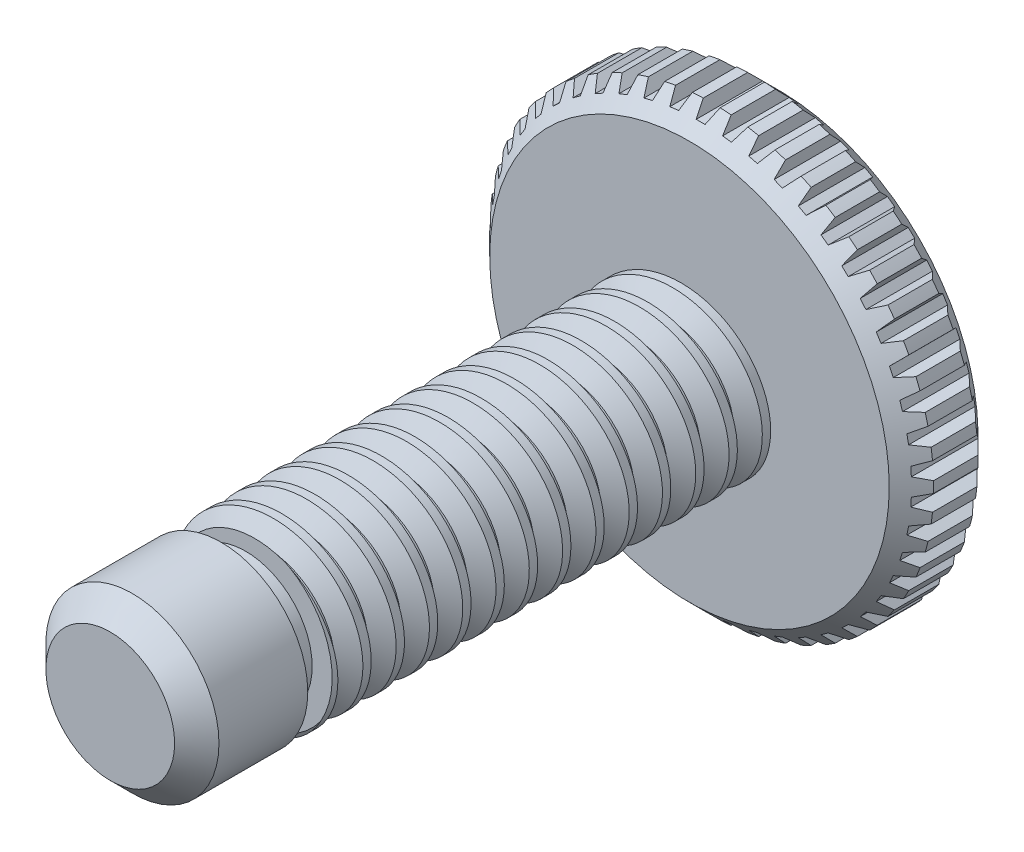
from build123d import *

# Parameters (mm, degrees)
SKETCH1_R           = 3.9
BOSS_EXTRUDE1_DEPTH = 20
THREAD1_PITCH       = 1.5
SKETCH2_R           = 10
BOSS_EXTRUDE2_DEPTH = 4
SKETCH3_R           = 3
BOSS_EXTRUDE3_DEPTH = 1.1
SKETCH4_R           = 3.9
BOSS_EXTRUDE4_DEPTH = 5
CHAMFER1_SIZE       = 1
CUT_EXTRUDE1_DEPTH  = 5
CHAMFER2_SIZE       = 1


with BuildPart() as part:
    # Sketch1 → Boss-Extrude1 (new body)
    with BuildSketch(Plane.XY):
        Circle(SKETCH1_R)
    extrude(amount=BOSS_EXTRUDE1_DEPTH)

    # Thread1: the profile of Thread Profile1 profile screwed along a right-hand helix of 16.666667 turns, 8 arcs to a turn; built about Z, then put on its axis
    thread1_z = Axis((0, 0, 0), (0, 0, 1))
    thread1_corners = [(3.9003, 0, -0.000173205), (3.088101187, 0, 0.468749998), (3.088101187, 0, 0.656249998), (3.9003, 0, 1.125173201)]
    with BuildLine(mode=Mode.PRIVATE) as thread1_profile:
        Line(thread1_corners[0], thread1_corners[1])
        Line(thread1_corners[1], thread1_corners[2])
        Line(thread1_corners[2], thread1_corners[3])
        Line(thread1_corners[3], thread1_corners[0])
    thread1_cap = Face(thread1_profile.wire())
    thread1_turn_angles = [0, 22.5, 45, 67.5, 90, 112.5, 135, 157.5, 180, 202.5, 225, 247.5, 270, 292.5, 315, 337.5, 360]
    thread1_turn_weights = [1, 0.9238795325112867, 1, 0.9238795325112867, 1, 0.9238795325112867, 1, 0.9238795325112867, 1, 0.9238795325112867, 1, 0.9238795325112867, 1, 0.9238795325112867, 1, 0.9238795325112867, 1]
    thread1_turn_rails = [Edge.make_bspline([Vector(p[0], p[1], 0).rotate(thread1_z, thread1_turn_angles[k]) / thread1_turn_weights[k] + Vector(0, 0, p[2] + THREAD1_PITCH * thread1_turn_angles[k] / 360) for k in range(17)], [0, 0, 0, 1, 1, 2, 2, 3, 3, 4, 4, 5, 5, 6, 6, 7, 7, 8, 8, 8], 2, thread1_turn_weights) for p in thread1_corners]
    thread1_turn_sides = [Face.make_surface_from_curves(thread1_turn_rails[p[0]], thread1_turn_rails[p[1]]) for p in [(0, 1), (1, 2), (2, 3), (3, 0)]]
    thread1_last_angles = [5760, 5782.5, 5805, 5827.5, 5850, 5872.5, 5895, 5917.5, 5940, 5962.5, 5985, 5992.5, 6000]
    thread1_last_weights = [1, 0.9238795325112867, 1, 0.9238795325112867, 1, 0.9238795325112867, 1, 0.9238795325112867, 1, 0.9238795325112867, 1, 0.9914448613738115, 1]
    thread1_last_rails = [Edge.make_bspline([Vector(p[0], p[1], 0).rotate(thread1_z, thread1_last_angles[k]) / thread1_last_weights[k] + Vector(0, 0, p[2] + THREAD1_PITCH * thread1_last_angles[k] / 360) for k in range(13)], [0, 0, 0, 1, 1, 2, 2, 3, 3, 4, 4, 5, 5, 6, 6, 6], 2, thread1_last_weights) for p in thread1_corners]
    thread1_last_sides = [Face.make_surface_from_curves(thread1_last_rails[p[0]], thread1_last_rails[p[1]]) for p in [(0, 1), (1, 2), (2, 3), (3, 0)]]
    thread1 = Plane(origin=(0, 0, 22), x_dir=(-1, 0, 0), z_dir=(0, 0, -1)) * Solid(Shell([*[p.moved(Location((0, 0, THREAD1_PITCH * i))) for i in range(16) for p in thread1_turn_sides], *thread1_last_sides, thread1_cap, thread1_cap.rotate(thread1_z, 6000).moved(Location((0, 0, THREAD1_PITCH * 6000 / 360)))]))
    add(thread1, mode=Mode.SUBTRACT)

    # Sketch2 → Boss-Extrude2 (add)
    with BuildSketch(Plane(origin=(0, 0, 0), x_dir=(-1, 0, 0), z_dir=(0, 0, -1))):
        Circle(SKETCH2_R)
    extrude(amount=BOSS_EXTRUDE2_DEPTH)

    # Sketch3 → Boss-Extrude3 (add)
    with BuildSketch(Plane.XY.offset(20)):
        Circle(SKETCH3_R)
    extrude(amount=BOSS_EXTRUDE3_DEPTH)

    # Sketch4 → Boss-Extrude4 (add)
    with BuildSketch(Plane.XY.offset(21.1)):
        Circle(SKETCH4_R)
    extrude(amount=BOSS_EXTRUDE4_DEPTH)

    # Chamfer1
    chamfer1_edges = [part.edges().sort_by_distance(p)[0] for p in [
        (10, 0, 0),
        (10, 0, -4),
    ]]
    chamfer(chamfer1_edges, length=CHAMFER1_SIZE)

    # Sketch5 → Cut-Extrude1 (cut)
    with BuildSketch(Plane(origin=(0, 0, -4), x_dir=(-1, 0, 0), z_dir=(0, 0, -1))):
        with BuildLine():
            Line((-0.2, 9.5), (0.2, 9.5))
            Line((0.2, 9.5), (0.379365083, 9.992801516))
            ThreePointArc((0.379365083, 9.992801516), (0, 10.02266576), (-0.379365083, 9.992801516))
            Line((-0.379365083, 9.992801516), (-0.2, 9.5))
        make_face()
        with BuildLine():
            Line((1.389088659, 9.400023016), (1.628803802, 9.866458239))
            ThreePointArc((1.628803802, 9.866458239), (1.256173109, 9.943634046), (0.87605645, 9.961552344))
            Line((0.87605645, 9.961552344), (0.992242779, 9.450156309))
            Line((0.992242779, 9.450156309), (1.389088659, 9.400023016))
        make_face()
        with BuildLine():
            Line((2.55627056, 9.151802053), (2.852555313, 9.584515021))
            ThreePointArc((2.852555313, 9.584515021), (2.492535617, 9.707785284), (2.11766205, 9.77320354))
            Line((2.11766205, 9.77320354), (2.168837296, 9.251278008))
            Line((2.168837296, 9.251278008), (2.55627056, 9.151802053))
        make_face()
        with BuildLine():
            Line((3.683138548, 8.759251705), (4.031320322, 9.151418276))
            ThreePointArc((4.031320322, 9.151418276), (3.689589349, 9.318838949), (3.325870854, 9.430725479))
            Line((3.325870854, 9.430725479), (3.311227953, 8.906501526))
            Line((3.311227953, 8.906501526), (3.683138548, 8.759251705))
        make_face()
        with BuildLine():
            Line((4.75192124, 8.228562726), (5.146509001, 8.573998198))
            ThreePointArc((5.146509001, 8.573998198), (4.828456054, 8.782928957), (4.481628688, 8.939519243))
            Line((4.481628688, 8.939519243), (4.401398568, 8.421264195))
            Line((4.401398568, 8.421264195), (4.75192124, 8.228562726))
        make_face()
        with BuildLine():
            Line((5.745763296, 7.568104396), (6.180534159, 7.861361047))
            ThreePointArc((6.180534159, 7.861361047), (5.891175122, 8.108506928), (5.566708561, 8.307331449))
            Line((5.566708561, 8.307331449), (5.422156498, 7.803218497))
            Line((5.422156498, 7.803218497), (5.745763296, 7.568104396))
        make_face()
        with BuildLine():
            Line((6.648991232, 6.788292539), (7.117088602, 7.024745535))
            ThreePointArc((7.117088602, 7.024745535), (6.860986839, 7.306208902), (6.563998114, 7.544132075))
            Line((6.563998114, 7.544132075), (6.357403781, 7.062111382))
            Line((6.357403781, 7.062111382), (6.648991232, 6.788292539))
        make_face()
        with BuildLine():
            Line((7.447360604, 5.901425254), (7.941402305, 6.077345591))
            ThreePointArc((7.941402305, 6.077345591), (7.722596696, 6.388687596), (7.457769495, 6.661957231))
            Line((7.457769495, 6.661957231), (7.192391008, 6.209630551))
            Line((7.192391008, 6.209630551), (7.447360604, 5.901425254))
        make_face()
        with BuildLine():
            Line((8.128280651, 4.921488967), (8.64047535, 5.034102275))
            ThreePointArc((8.64047535, 5.034102275), (8.462416589, 5.370412871), (8.233927397, 5.674719343))
            Line((8.233927397, 5.674719343), (7.913949933, 5.259220137))
            Line((7.913949933, 5.259220137), (8.128280651, 4.921488967))
        make_face()
        with BuildLine():
            Line((8.681012857, 3.863937859), (9.203282938, 3.91146816))
            ThreePointArc((9.203282938, 3.91146816), (9.068779117, 4.267443527), (8.880231345, 4.59798774))
            Line((8.880231345, 4.59798774), (8.51070114, 4.22586868))
            Line((8.51070114, 4.22586868), (8.681012857, 3.863937859))
        make_face()
        with BuildLine():
            Line((9.096840304, 2.745450143), (9.620949255, 2.727147855))
            ThreePointArc((9.620949255, 2.727147855), (9.532121581, 3.097174049), (9.38648874, 3.448743124))
            Line((9.38648874, 3.448743124), (8.973233506, 3.12587275))
            Line((8.973233506, 3.12587275), (9.096840304, 2.745450143))
        make_face()
        with BuildLine():
            Line((9.369205145, 1.583665038), (9.886887456, 1.4998188))
            ThreePointArc((9.886887456, 1.4998188), (9.845136794, 1.878060286), (9.7447156, 2.245109769))
            Line((9.7447156, 2.245109769), (9.294252619, 1.976579939))
            Line((9.294252619, 1.976579939), (9.369205145, 1.583665038))
        make_face()
        with BuildLine():
            Line((9.493812024, 0.39690459), (9.996903535, 0.248836706))
            ThreePointArc((9.996903535, 0.248836706), (10.002888318, 0.62932839), (9.949262474, 1.006069692))
            Line((9.949262474, 1.006069692), (9.468695816, 0.796115281))
            Line((9.468695816, 0.796115281), (9.493812024, 0.39690459))
        make_face()
        with BuildLine():
            Line((9.468695816, -0.796115281), (9.949262474, -1.006069692))
            ThreePointArc((9.949262474, -1.006069692), (10.002888318, -0.62932839), (9.996903535, -0.248836706))
            Line((9.996903535, -0.248836706), (9.493812024, -0.39690459))
            Line((9.493812024, -0.39690459), (9.468695816, -0.796115281))
        make_face()
        with BuildLine():
            Line((9.294252619, -1.976579939), (9.7447156, -2.245109769))
            ThreePointArc((9.7447156, -2.245109769), (9.845136794, -1.878060286), (9.886887456, -1.4998188))
            Line((9.886887456, -1.4998188), (9.369205145, -1.583665038))
            Line((9.369205145, -1.583665038), (9.294252619, -1.976579939))
        make_face()
        with BuildLine():
            Line((8.973233506, -3.12587275), (9.38648874, -3.448743124))
            ThreePointArc((9.38648874, -3.448743124), (9.532121581, -3.097174049), (9.620949255, -2.727147855))
            Line((9.620949255, -2.727147855), (9.096840304, -2.745450143))
            Line((9.096840304, -2.745450143), (8.973233506, -3.12587275))
        make_face()
        with BuildLine():
            Line((8.51070114, -4.22586868), (8.880231345, -4.59798774))
            ThreePointArc((8.880231345, -4.59798774), (9.068779117, -4.267443527), (9.203282938, -3.91146816))
            Line((9.203282938, -3.91146816), (8.681012857, -3.863937859))
            Line((8.681012857, -3.863937859), (8.51070114, -4.22586868))
        make_face()
        with BuildLine():
            Line((7.913949933, -5.259220137), (8.233927397, -5.674719343))
            ThreePointArc((8.233927397, -5.674719343), (8.462416589, -5.370412871), (8.64047535, -5.034102275))
            Line((8.64047535, -5.034102275), (8.128280651, -4.921488967))
            Line((8.128280651, -4.921488967), (7.913949933, -5.259220137))
        make_face()
        with BuildLine():
            Line((7.192391008, -6.209630551), (7.457769495, -6.661957231))
            ThreePointArc((7.457769495, -6.661957231), (7.722596696, -6.388687596), (7.941402305, -6.077345591))
            Line((7.941402305, -6.077345591), (7.447360604, -5.901425254))
            Line((7.447360604, -5.901425254), (7.192391008, -6.209630551))
        make_face()
        with BuildLine():
            Line((6.357403781, -7.062111382), (6.563998114, -7.544132075))
            ThreePointArc((6.563998114, -7.544132075), (6.860986839, -7.306208902), (7.117088602, -7.024745535))
            Line((7.117088602, -7.024745535), (6.648991232, -6.788292539))
            Line((6.648991232, -6.788292539), (6.357403781, -7.062111382))
        make_face()
        with BuildLine():
            Line((5.422156498, -7.803218497), (5.566708561, -8.307331449))
            ThreePointArc((5.566708561, -8.307331449), (5.891175122, -8.108506928), (6.180534159, -7.861361047))
            Line((6.180534159, -7.861361047), (5.745763296, -7.568104396))
            Line((5.745763296, -7.568104396), (5.422156498, -7.803218497))
        make_face()
        with BuildLine():
            Line((4.401398568, -8.421264195), (4.481628688, -8.939519243))
            ThreePointArc((4.481628688, -8.939519243), (4.828456054, -8.782928957), (5.146509001, -8.573998198))
            Line((5.146509001, -8.573998198), (4.75192124, -8.228562726))
            Line((4.75192124, -8.228562726), (4.401398568, -8.421264195))
        make_face()
        with BuildLine():
            Line((3.311227953, -8.906501526), (3.325870854, -9.430725479))
            ThreePointArc((3.325870854, -9.430725479), (3.689589349, -9.318838949), (4.031320322, -9.151418276))
            Line((4.031320322, -9.151418276), (3.683138548, -8.759251705))
            Line((3.683138548, -8.759251705), (3.311227953, -8.906501526))
        make_face()
        with BuildLine():
            Line((2.168837296, -9.251278008), (2.11766205, -9.77320354))
            ThreePointArc((2.11766205, -9.77320354), (2.492535617, -9.707785284), (2.852555313, -9.584515021))
            Line((2.852555313, -9.584515021), (2.55627056, -9.151802053))
            Line((2.55627056, -9.151802053), (2.168837296, -9.251278008))
        make_face()
        with BuildLine():
            Line((0.992242779, -9.450156309), (0.87605645, -9.961552344))
            ThreePointArc((0.87605645, -9.961552344), (1.256173109, -9.943634046), (1.628803802, -9.866458239))
            Line((1.628803802, -9.866458239), (1.389088659, -9.400023016))
            Line((1.389088659, -9.400023016), (0.992242779, -9.450156309))
        make_face()
        with BuildLine():
            Line((-0.2, -9.5), (-0.379365083, -9.992801516))
            ThreePointArc((-0.379365083, -9.992801516), (0, -10.02266576), (0.379365083, -9.992801516))
            Line((0.379365083, -9.992801516), (0.2, -9.5))
            Line((0.2, -9.5), (-0.2, -9.5))
        make_face()
        with BuildLine():
            Line((-1.389088659, -9.400023016), (-1.628803802, -9.866458239))
            ThreePointArc((-1.628803802, -9.866458239), (-1.256173109, -9.943634046), (-0.87605645, -9.961552344))
            Line((-0.87605645, -9.961552344), (-0.992242779, -9.450156309))
            Line((-0.992242779, -9.450156309), (-1.389088659, -9.400023016))
        make_face()
        with BuildLine():
            Line((-2.55627056, -9.151802053), (-2.852555313, -9.584515021))
            ThreePointArc((-2.852555313, -9.584515021), (-2.492535617, -9.707785284), (-2.11766205, -9.77320354))
            Line((-2.11766205, -9.77320354), (-2.168837296, -9.251278008))
            Line((-2.168837296, -9.251278008), (-2.55627056, -9.151802053))
        make_face()
        with BuildLine():
            Line((-3.683138548, -8.759251705), (-4.031320322, -9.151418276))
            ThreePointArc((-4.031320322, -9.151418276), (-3.689589349, -9.318838949), (-3.325870854, -9.430725479))
            Line((-3.325870854, -9.430725479), (-3.311227953, -8.906501526))
            Line((-3.311227953, -8.906501526), (-3.683138548, -8.759251705))
        make_face()
        with BuildLine():
            Line((-4.75192124, -8.228562726), (-5.146509001, -8.573998198))
            ThreePointArc((-5.146509001, -8.573998198), (-4.828456054, -8.782928957), (-4.481628688, -8.939519243))
            Line((-4.481628688, -8.939519243), (-4.401398568, -8.421264195))
            Line((-4.401398568, -8.421264195), (-4.75192124, -8.228562726))
        make_face()
        with BuildLine():
            Line((-5.745763296, -7.568104396), (-6.180534159, -7.861361047))
            ThreePointArc((-6.180534159, -7.861361047), (-5.891175122, -8.108506928), (-5.566708561, -8.307331449))
            Line((-5.566708561, -8.307331449), (-5.422156498, -7.803218497))
            Line((-5.422156498, -7.803218497), (-5.745763296, -7.568104396))
        make_face()
        with BuildLine():
            Line((-6.648991232, -6.788292539), (-7.117088602, -7.024745535))
            ThreePointArc((-7.117088602, -7.024745535), (-6.860986839, -7.306208902), (-6.563998114, -7.544132075))
            Line((-6.563998114, -7.544132075), (-6.357403781, -7.062111382))
            Line((-6.357403781, -7.062111382), (-6.648991232, -6.788292539))
        make_face()
        with BuildLine():
            Line((-7.447360604, -5.901425254), (-7.941402305, -6.077345591))
            ThreePointArc((-7.941402305, -6.077345591), (-7.722596696, -6.388687596), (-7.457769495, -6.661957231))
            Line((-7.457769495, -6.661957231), (-7.192391008, -6.209630551))
            Line((-7.192391008, -6.209630551), (-7.447360604, -5.901425254))
        make_face()
        with BuildLine():
            Line((-8.128280651, -4.921488967), (-8.64047535, -5.034102275))
            ThreePointArc((-8.64047535, -5.034102275), (-8.462416589, -5.370412871), (-8.233927397, -5.674719343))
            Line((-8.233927397, -5.674719343), (-7.913949933, -5.259220137))
            Line((-7.913949933, -5.259220137), (-8.128280651, -4.921488967))
        make_face()
        with BuildLine():
            Line((-8.681012857, -3.863937859), (-9.203282938, -3.91146816))
            ThreePointArc((-9.203282938, -3.91146816), (-9.068779117, -4.267443527), (-8.880231345, -4.59798774))
            Line((-8.880231345, -4.59798774), (-8.51070114, -4.22586868))
            Line((-8.51070114, -4.22586868), (-8.681012857, -3.863937859))
        make_face()
        with BuildLine():
            Line((-9.096840304, -2.745450143), (-9.620949255, -2.727147855))
            ThreePointArc((-9.620949255, -2.727147855), (-9.532121581, -3.097174049), (-9.38648874, -3.448743124))
            Line((-9.38648874, -3.448743124), (-8.973233506, -3.12587275))
            Line((-8.973233506, -3.12587275), (-9.096840304, -2.745450143))
        make_face()
        with BuildLine():
            Line((-9.369205145, -1.583665038), (-9.886887456, -1.4998188))
            ThreePointArc((-9.886887456, -1.4998188), (-9.845136794, -1.878060286), (-9.7447156, -2.245109769))
            Line((-9.7447156, -2.245109769), (-9.294252619, -1.976579939))
            Line((-9.294252619, -1.976579939), (-9.369205145, -1.583665038))
        make_face()
        with BuildLine():
            Line((-9.493812024, -0.39690459), (-9.996903535, -0.248836706))
            ThreePointArc((-9.996903535, -0.248836706), (-10.002888318, -0.62932839), (-9.949262474, -1.006069692))
            Line((-9.949262474, -1.006069692), (-9.468695816, -0.796115281))
            Line((-9.468695816, -0.796115281), (-9.493812024, -0.39690459))
        make_face()
        with BuildLine():
            Line((-9.468695816, 0.796115281), (-9.949262474, 1.006069692))
            ThreePointArc((-9.949262474, 1.006069692), (-10.002888318, 0.62932839), (-9.996903535, 0.248836706))
            Line((-9.996903535, 0.248836706), (-9.493812024, 0.39690459))
            Line((-9.493812024, 0.39690459), (-9.468695816, 0.796115281))
        make_face()
        with BuildLine():
            Line((-9.294252619, 1.976579939), (-9.7447156, 2.245109769))
            ThreePointArc((-9.7447156, 2.245109769), (-9.845136794, 1.878060286), (-9.886887456, 1.4998188))
            Line((-9.886887456, 1.4998188), (-9.369205145, 1.583665038))
            Line((-9.369205145, 1.583665038), (-9.294252619, 1.976579939))
        make_face()
        with BuildLine():
            Line((-8.973233506, 3.12587275), (-9.38648874, 3.448743124))
            ThreePointArc((-9.38648874, 3.448743124), (-9.532121581, 3.097174049), (-9.620949255, 2.727147855))
            Line((-9.620949255, 2.727147855), (-9.096840304, 2.745450143))
            Line((-9.096840304, 2.745450143), (-8.973233506, 3.12587275))
        make_face()
        with BuildLine():
            Line((-8.51070114, 4.22586868), (-8.880231345, 4.59798774))
            ThreePointArc((-8.880231345, 4.59798774), (-9.068779117, 4.267443527), (-9.203282938, 3.91146816))
            Line((-9.203282938, 3.91146816), (-8.681012857, 3.863937859))
            Line((-8.681012857, 3.863937859), (-8.51070114, 4.22586868))
        make_face()
        with BuildLine():
            Line((-7.913949933, 5.259220137), (-8.233927397, 5.674719343))
            ThreePointArc((-8.233927397, 5.674719343), (-8.462416589, 5.370412871), (-8.64047535, 5.034102275))
            Line((-8.64047535, 5.034102275), (-8.128280651, 4.921488967))
            Line((-8.128280651, 4.921488967), (-7.913949933, 5.259220137))
        make_face()
        with BuildLine():
            Line((-7.192391008, 6.209630551), (-7.457769495, 6.661957231))
            ThreePointArc((-7.457769495, 6.661957231), (-7.722596696, 6.388687596), (-7.941402305, 6.077345591))
            Line((-7.941402305, 6.077345591), (-7.447360604, 5.901425254))
            Line((-7.447360604, 5.901425254), (-7.192391008, 6.209630551))
        make_face()
        with BuildLine():
            Line((-6.357403781, 7.062111382), (-6.563998114, 7.544132075))
            ThreePointArc((-6.563998114, 7.544132075), (-6.860986839, 7.306208902), (-7.117088602, 7.024745535))
            Line((-7.117088602, 7.024745535), (-6.648991232, 6.788292539))
            Line((-6.648991232, 6.788292539), (-6.357403781, 7.062111382))
        make_face()
        with BuildLine():
            Line((-5.422156498, 7.803218497), (-5.566708561, 8.307331449))
            ThreePointArc((-5.566708561, 8.307331449), (-5.891175122, 8.108506928), (-6.180534159, 7.861361047))
            Line((-6.180534159, 7.861361047), (-5.745763296, 7.568104396))
            Line((-5.745763296, 7.568104396), (-5.422156498, 7.803218497))
        make_face()
        with BuildLine():
            Line((-4.401398568, 8.421264195), (-4.481628688, 8.939519243))
            ThreePointArc((-4.481628688, 8.939519243), (-4.828456054, 8.782928957), (-5.146509001, 8.573998198))
            Line((-5.146509001, 8.573998198), (-4.75192124, 8.228562726))
            Line((-4.75192124, 8.228562726), (-4.401398568, 8.421264195))
        make_face()
        with BuildLine():
            Line((-3.311227953, 8.906501526), (-3.325870854, 9.430725479))
            ThreePointArc((-3.325870854, 9.430725479), (-3.689589349, 9.318838949), (-4.031320322, 9.151418276))
            Line((-4.031320322, 9.151418276), (-3.683138548, 8.759251705))
            Line((-3.683138548, 8.759251705), (-3.311227953, 8.906501526))
        make_face()
        with BuildLine():
            Line((-2.168837296, 9.251278008), (-2.11766205, 9.77320354))
            ThreePointArc((-2.11766205, 9.77320354), (-2.492535617, 9.707785284), (-2.852555313, 9.584515021))
            Line((-2.852555313, 9.584515021), (-2.55627056, 9.151802053))
            Line((-2.55627056, 9.151802053), (-2.168837296, 9.251278008))
        make_face()
        with BuildLine():
            Line((-0.992242779, 9.450156309), (-0.87605645, 9.961552344))
            ThreePointArc((-0.87605645, 9.961552344), (-1.256173109, 9.943634046), (-1.628803802, 9.866458239))
            Line((-1.628803802, 9.866458239), (-1.389088659, 9.400023016))
            Line((-1.389088659, 9.400023016), (-0.992242779, 9.450156309))
        make_face()
    extrude(amount=-CUT_EXTRUDE1_DEPTH, mode=Mode.SUBTRACT)

    # Chamfer2
    chamfer2_edges = [part.edges().sort_by_distance(p)[0] for p in [
        (-3.9, 0, 26.1),
    ]]
    chamfer(chamfer2_edges, length=CHAMFER2_SIZE)


solid = part.part
